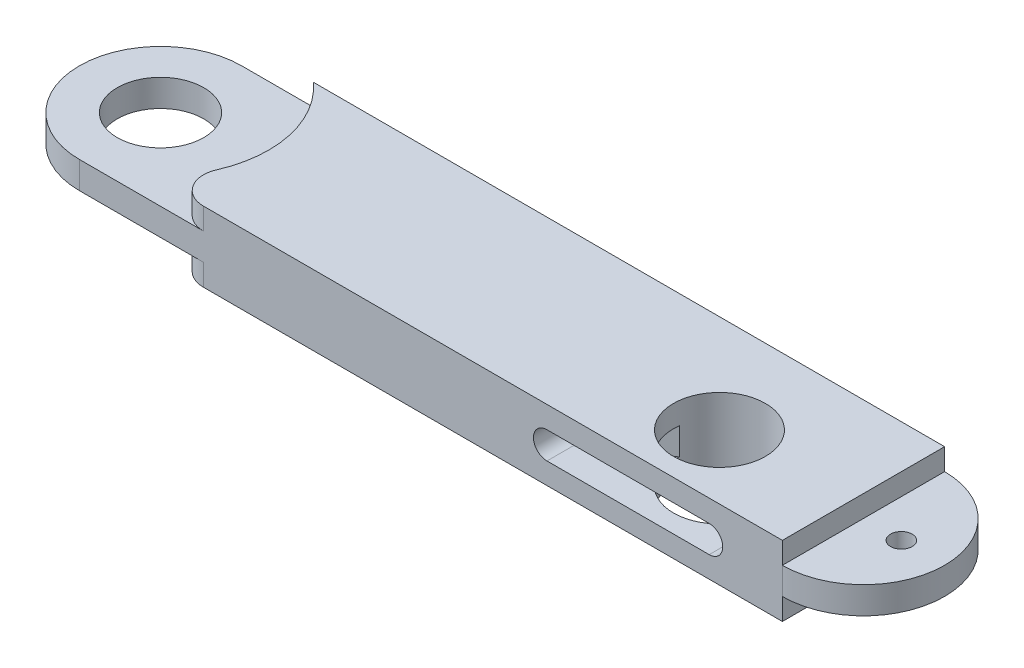
from build123d import *

# Parameters (mm, degrees)
MAIN_R              = 8
BOSS_EXTRUDE1_DEPTH = 13
CUT_EXTRUDE5_START  = -4
CUT_EXTRUDE5_DEPTH  = 4
CUT_EXTRUDE6_DEPTH  = 4
JOINT_HOLE_R        = 8.5
CUT_EXTRUDE7_DEPTH  = 13
CUT_EXTRUDE8_DEPTH  = 9
SKETCH9_R           = 20.014179858
CUT_EXTRUDE9_DEPTH  = 4
CUT_EXTRUDE10_START = -4
SKETCH10_R          = 20.014179858
CUT_EXTRUDE10_DEPTH = 4
FILLET1_R           = 5
FILLET2_R           = 5
CUT_EXTRUDE11_DEPTH = 5
CHAMFER1_START      = 3.94488544
CHAMFER1_DEPTH      = 5


with BuildPart() as part:
    # main → Boss-Extrude1 (new body)
    with BuildSketch(Plane(origin=(0, 0, 0), x_dir=(1, 0, 0), z_dir=(0, 1, 0))):
        with BuildLine():
            Line((0, 15), (130, 15))
            ThreePointArc((130, 15), (145, 0), (130, -15))
            Line((130, -15), (0, -15))
            ThreePointArc((0, -15), (-15, 0), (0, 15))
        make_face()
        with Locations(Location((0, 0, 0), (0, 0, 270))):
            Circle(MAIN_R, mode=Mode.SUBTRACT)
    extrude(amount=BOSS_EXTRUDE1_DEPTH)

    # Sketch5 → Cut-Extrude5 (cut)
    with BuildSketch(Plane(origin=(0, 13, 0), x_dir=(1, 0, 0), z_dir=(0, 1, 0)).offset(CUT_EXTRUDE5_START)):
        with BuildLine():
            Line((130, 15), (130, -15))
            ThreePointArc((130, -15), (145, 0), (130, 15))
        make_face()
    extrude(amount=CUT_EXTRUDE5_DEPTH, mode=Mode.SUBTRACT)

    # Sketch6 → Cut-Extrude6 (cut)
    with BuildSketch(Plane.XZ):
        with BuildLine():
            Line((130, 15), (130, -15))
            ThreePointArc((130, -15), (145, 0), (130, 15))
        make_face()
    extrude(amount=-CUT_EXTRUDE6_DEPTH, mode=Mode.SUBTRACT)

    # joint hole → Cut-Extrude7 (cut)
    with BuildSketch(Plane.XZ):
        with Locations(Location((106.49845917, 3.136605167, 0), (0, 0, 270))):
            Circle(JOINT_HOLE_R)
    extrude(amount=-CUT_EXTRUDE7_DEPTH, mode=Mode.SUBTRACT)

    # cut_out joint → Cut-Extrude8 (cut)
    with BuildSketch(Plane.XY.offset(15)):
        with BuildLine():
            Line((86.468116833, 8.94488544), (116.468116833, 8.94488544))
            ThreePointArc((116.468116833, 8.94488544), (118.968116833, 6.44488544), (116.468116833, 3.94488544))
            Line((116.468116833, 3.94488544), (86.468116833, 3.94488544))
            ThreePointArc((86.468116833, 3.94488544), (83.968116833, 6.44488544), (86.468116833, 8.94488544))
        make_face()
    extrude(amount=-CUT_EXTRUDE8_DEPTH, mode=Mode.SUBTRACT)

    # Sketch9 → Cut-Extrude9 (cut)
    with BuildSketch(Plane(origin=(0, 13, 0), x_dir=(1, 0, 0), z_dir=(0, 1, 0))):
        Circle(SKETCH9_R)
    extrude(amount=-CUT_EXTRUDE9_DEPTH, mode=Mode.SUBTRACT)

    # Sketch10 → Cut-Extrude10 (cut)
    with BuildSketch(Plane.XZ.offset(CUT_EXTRUDE10_START)):
        Circle(SKETCH10_R)
    extrude(amount=CUT_EXTRUDE10_DEPTH, mode=Mode.SUBTRACT)

    # Fillet1
    fillet1_edges = [part.edges().sort_by_distance(p)[0] for p in [
        (13.25018473, 2, 15),
    ]]
    fillet(fillet1_edges, radius=FILLET1_R)

    # Fillet2
    fillet2_edges = [part.edges().sort_by_distance(p)[0] for p in [
        (13.25018473, 11, 15),
    ]]
    fillet(fillet2_edges, radius=FILLET2_R)

    # Sketch11 → Cut-Extrude11 (cut)
    with BuildSketch(Plane(origin=(0, 9, 0), x_dir=(1, 0, 0), z_dir=(0, 1, 0))):
        with BuildLine():
            ThreePointArc((136.154229069, 1.81236628), (135, 0), (136.154229069, -1.81236628))
            Line((136.154229069, -1.81236628), (137, 0))
            Line((137, 0), (136.154229069, 1.81236628))
        make_face()
        with BuildLine():
            Line((137, 0), (136.154229069, -1.81236628))
            ThreePointArc((136.154229069, -1.81236628), (138.074350534, -1.686941294), (139, 0))
            ThreePointArc((139, 0), (138.074350534, 1.686941294), (136.154229069, 1.81236628))
            Line((136.154229069, 1.81236628), (137, 0))
        make_face()
    extrude(amount=-CUT_EXTRUDE11_DEPTH, mode=Mode.SUBTRACT)

    # Chamfer1: read off the stored shape, not the designer's step
    # Chamfer1 outline → Chamfer1 (cut)
    with BuildSketch(Plane(origin=(0, 0, 0), x_dir=(1, 0, 0), z_dir=(0, 1, 0)).offset(CHAMFER1_START)):
        with BuildLine():
            Line((98.059452794, -2.120154778), (92.162759821, -6))
            Line((92.162759821, -6), (98.495274177, -6))
            ThreePointArc((98.495274177, -6), (98.05158318, -4.085439196), (98.059452794, -2.120154778))
        make_face()
    extrude(amount=CHAMFER1_DEPTH, mode=Mode.SUBTRACT)


solid = part.part
